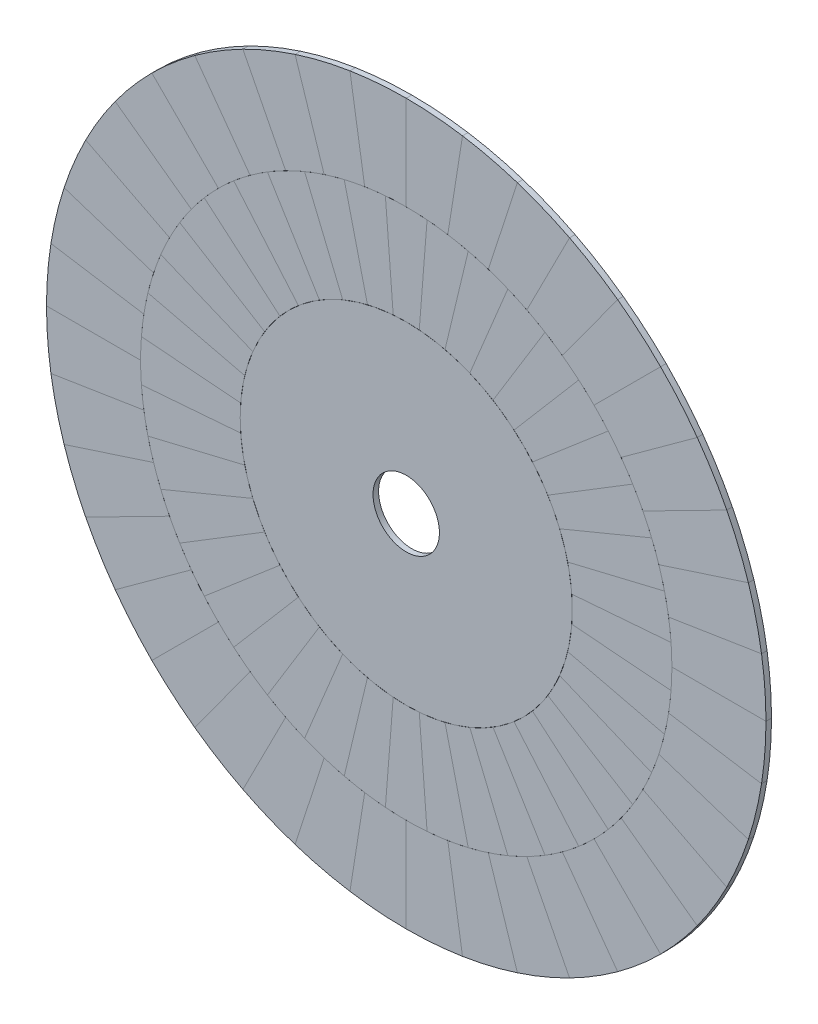
from build123d import *

# Parameters (mm, degrees)
BOSS_EXTRUDE1_DEPTH    = 0.5
BOSS_EXTRUDE1_2_DEPTH  = 0.5
BOSS_EXTRUDE1_3_DEPTH  = 0.5
BOSS_EXTRUDE1_4_DEPTH  = 0.5
BOSS_EXTRUDE1_5_DEPTH  = 0.5
BOSS_EXTRUDE1_6_DEPTH  = 0.5
BOSS_EXTRUDE1_7_DEPTH  = 0.5
BOSS_EXTRUDE1_8_DEPTH  = 0.5
BOSS_EXTRUDE1_9_DEPTH  = 0.5
BOSS_EXTRUDE1_10_DEPTH = 0.5
BOSS_EXTRUDE1_11_DEPTH = 0.5
BOSS_EXTRUDE1_12_DEPTH = 0.5
BOSS_EXTRUDE1_13_DEPTH = 0.5
BOSS_EXTRUDE1_14_DEPTH = 0.5
BOSS_EXTRUDE1_15_DEPTH = 0.5
BOSS_EXTRUDE1_16_DEPTH = 0.5
BOSS_EXTRUDE1_17_DEPTH = 0.5
BOSS_EXTRUDE1_18_DEPTH = 0.5
BOSS_EXTRUDE1_19_DEPTH = 0.5
BOSS_EXTRUDE1_20_DEPTH = 0.5
BOSS_EXTRUDE2_DEPTH    = 0.5
BOSS_EXTRUDE2_2_DEPTH  = 0.5
BOSS_EXTRUDE2_3_DEPTH  = 0.5
BOSS_EXTRUDE2_4_DEPTH  = 0.5
BOSS_EXTRUDE2_5_DEPTH  = 0.5
BOSS_EXTRUDE2_6_DEPTH  = 0.5
BOSS_EXTRUDE2_7_DEPTH  = 0.5
BOSS_EXTRUDE2_8_DEPTH  = 0.5
BOSS_EXTRUDE2_9_DEPTH  = 0.5
BOSS_EXTRUDE2_10_DEPTH = 0.5
BOSS_EXTRUDE2_11_DEPTH = 0.5
BOSS_EXTRUDE2_12_DEPTH = 0.5
BOSS_EXTRUDE2_13_DEPTH = 0.5
BOSS_EXTRUDE2_14_DEPTH = 0.5
BOSS_EXTRUDE2_15_DEPTH = 0.5
BOSS_EXTRUDE2_16_DEPTH = 0.5
BOSS_EXTRUDE2_17_DEPTH = 0.5
BOSS_EXTRUDE2_18_DEPTH = 0.5
BOSS_EXTRUDE2_19_DEPTH = 0.5
BOSS_EXTRUDE2_20_DEPTH = 0.5
BOSS_EXTRUDE3_DEPTH    = 0.5
BOSS_EXTRUDE3_2_DEPTH  = 0.5
BOSS_EXTRUDE3_3_DEPTH  = 0.5
BOSS_EXTRUDE3_4_DEPTH  = 0.5
BOSS_EXTRUDE3_5_DEPTH  = 0.5
BOSS_EXTRUDE3_6_DEPTH  = 0.5
BOSS_EXTRUDE3_7_DEPTH  = 0.5
BOSS_EXTRUDE3_8_DEPTH  = 0.5
BOSS_EXTRUDE3_9_DEPTH  = 0.5
BOSS_EXTRUDE3_10_DEPTH = 0.5
BOSS_EXTRUDE3_11_DEPTH = 0.5
BOSS_EXTRUDE3_12_DEPTH = 0.5
BOSS_EXTRUDE3_13_DEPTH = 0.5
BOSS_EXTRUDE3_14_DEPTH = 0.5
BOSS_EXTRUDE3_15_DEPTH = 0.5
BOSS_EXTRUDE3_16_DEPTH = 0.5
BOSS_EXTRUDE3_17_DEPTH = 0.5
BOSS_EXTRUDE3_18_DEPTH = 0.5
BOSS_EXTRUDE3_19_DEPTH = 0.5
BOSS_EXTRUDE3_20_DEPTH = 0.5
BOSS_EXTRUDE4_DEPTH    = 0.5
BOSS_EXTRUDE4_2_DEPTH  = 0.5
BOSS_EXTRUDE4_3_DEPTH  = 0.5
BOSS_EXTRUDE4_4_DEPTH  = 0.5
BOSS_EXTRUDE4_5_DEPTH  = 0.5
BOSS_EXTRUDE4_6_DEPTH  = 0.5
BOSS_EXTRUDE4_7_DEPTH  = 0.5
BOSS_EXTRUDE4_8_DEPTH  = 0.5
BOSS_EXTRUDE4_9_DEPTH  = 0.5
BOSS_EXTRUDE4_10_DEPTH = 0.5
BOSS_EXTRUDE4_11_DEPTH = 0.5
BOSS_EXTRUDE4_12_DEPTH = 0.5
BOSS_EXTRUDE4_13_DEPTH = 0.5
BOSS_EXTRUDE4_14_DEPTH = 0.5
BOSS_EXTRUDE4_15_DEPTH = 0.5
BOSS_EXTRUDE4_16_DEPTH = 0.5
BOSS_EXTRUDE4_17_DEPTH = 0.5
BOSS_EXTRUDE4_18_DEPTH = 0.5
BOSS_EXTRUDE4_19_DEPTH = 0.5
BOSS_EXTRUDE4_20_DEPTH = 0.5
SKETCH1_9_R            = 3
BOSS_EXTRUDE6_DEPTH    = 0.5


with BuildPart() as part:
    # Sketch1 → Boss-Extrude1 (new body)
    with BuildSketch(Plane.XY):
        with BuildLine():
            ThreePointArc((23.704520174, 3.754427161), (23.92601601, 1.883018297), (24, 0))
            Line((24, 0), (32.5, 0))
            ThreePointArc((32.5, 0), (32.399813346, 2.549920611), (32.099871069, 5.084120114))
            Line((32.099871069, 5.084120114), (23.704520174, 3.754427161))
        make_face()
    extrude(amount=BOSS_EXTRUDE1_DEPTH)


with BuildPart() as body_2:
    # Sketch1 → Boss-Extrude1 2 (new body)
    with BuildSketch(Plane.XY):
        with BuildLine():
            ThreePointArc((30.90933678, -10.043052317), (31.602022413, -7.586974325), (32.099871069, -5.084120114))
            Line((32.099871069, -5.084120114), (23.704520174, -3.754427161))
            ThreePointArc((23.704520174, -3.754427161), (23.33687809, -5.602688733), (22.825356391, -7.416407865))
            Line((22.825356391, -7.416407865), (30.90933678, -10.043052317))
        make_face()
    extrude(amount=BOSS_EXTRUDE1_2_DEPTH)


with BuildPart() as body_3:
    # Sketch1 → Boss-Extrude1 3 (new body)
    with BuildSketch(Plane.XY):
        with BuildLine():
            Line((22.825356391, 7.416407865), (30.90933678, 10.043052317))
            ThreePointArc((30.90933678, 10.043052317), (30.026084807, 12.437211552), (28.957712036, 14.754691242))
            Line((28.957712036, 14.754691242), (21.384156581, 10.895771994))
            ThreePointArc((21.384156581, 10.895771994), (22.17310878, 9.184402377), (22.825356391, 7.416407865))
        make_face()
    extrude(amount=BOSS_EXTRUDE1_3_DEPTH)


with BuildPart() as body_4:
    # Sketch1 → Boss-Extrude1 4 (new body)
    with BuildSketch(Plane.XY):
        with BuildLine():
            ThreePointArc((26.293052317, -19.1030207), (27.710805342, -16.981203353), (28.957712036, -14.754691242))
            Line((28.957712036, -14.754691242), (21.384156581, -10.895771994))
            ThreePointArc((21.384156581, -10.895771994), (20.463363944, -12.539965553), (19.416407865, -14.106846055))
            Line((19.416407865, -14.106846055), (26.293052317, -19.1030207))
        make_face()
    extrude(amount=BOSS_EXTRUDE1_4_DEPTH)


with BuildPart() as body_5:
    # Sketch1 → Boss-Extrude1 5 (new body)
    with BuildSketch(Plane.XY):
        with BuildLine():
            Line((19.416407865, 14.106846055), (26.293052317, 19.1030207))
            ThreePointArc((26.293052317, 19.1030207), (24.713193882, 21.107061571), (22.980970389, 22.980970389))
            Line((22.980970389, 22.980970389), (16.970562748, 16.970562748))
            ThreePointArc((16.970562748, 16.970562748), (18.249743174, 15.58675316), (19.416407865, 14.106846055))
        make_face()
    extrude(amount=BOSS_EXTRUDE1_5_DEPTH)


with BuildPart() as body_6:
    # Sketch1 → Boss-Extrude1 6 (new body)
    with BuildSketch(Plane.XY):
        with BuildLine():
            ThreePointArc((19.1030207, -26.293052317), (21.107061571, -24.713193882), (22.980970389, -22.980970389))
            Line((22.980970389, -22.980970389), (16.970562748, -16.970562748))
            ThreePointArc((16.970562748, -16.970562748), (15.58675316, -18.249743174), (14.106846055, -19.416407865))
            Line((14.106846055, -19.416407865), (19.1030207, -26.293052317))
        make_face()
    extrude(amount=BOSS_EXTRUDE1_6_DEPTH)


with BuildPart() as body_7:
    # Sketch1 → Boss-Extrude1 7 (new body)
    with BuildSketch(Plane.XY):
        with BuildLine():
            Line((14.106846055, 19.416407865), (19.1030207, 26.293052317))
            ThreePointArc((19.1030207, 26.293052317), (16.981203353, 27.710805342), (14.754691242, 28.957712036))
            Line((14.754691242, 28.957712036), (10.895771994, 21.384156581))
            ThreePointArc((10.895771994, 21.384156581), (12.539965553, 20.463363944), (14.106846055, 19.416407865))
        make_face()
    extrude(amount=BOSS_EXTRUDE1_7_DEPTH)


with BuildPart() as body_8:
    # Sketch1 → Boss-Extrude1 8 (new body)
    with BuildSketch(Plane.XY):
        with BuildLine():
            ThreePointArc((10.043052317, -30.90933678), (12.437211552, -30.026084807), (14.754691242, -28.957712036))
            Line((14.754691242, -28.957712036), (10.895771994, -21.384156581))
            ThreePointArc((10.895771994, -21.384156581), (9.184402377, -22.17310878), (7.416407865, -22.825356391))
            Line((7.416407865, -22.825356391), (10.043052317, -30.90933678))
        make_face()
    extrude(amount=BOSS_EXTRUDE1_8_DEPTH)


with BuildPart() as body_9:
    # Sketch1 → Boss-Extrude1 9 (new body)
    with BuildSketch(Plane.XY):
        with BuildLine():
            Line((7.416407865, 22.825356391), (10.043052317, 30.90933678))
            ThreePointArc((10.043052317, 30.90933678), (7.586974325, 31.602022413), (5.084120114, 32.099871069))
            Line((5.084120114, 32.099871069), (3.754427161, 23.704520174))
            ThreePointArc((3.754427161, 23.704520174), (5.602688733, 23.33687809), (7.416407865, 22.825356391))
        make_face()
    extrude(amount=BOSS_EXTRUDE1_9_DEPTH)


with BuildPart() as body_10:
    # Sketch1 → Boss-Extrude1 10 (new body)
    with BuildSketch(Plane.XY):
        with BuildLine():
            ThreePointArc((0, -32.5), (2.549920611, -32.399813346), (5.084120114, -32.099871069))
            Line((5.084120114, -32.099871069), (3.754427161, -23.704520174))
            ThreePointArc((3.754427161, -23.704520174), (1.883018297, -23.92601601), (0, -24))
            Line((0, -24), (0, -32.5))
        make_face()
    extrude(amount=BOSS_EXTRUDE1_10_DEPTH)


with BuildPart() as body_11:
    # Sketch1 → Boss-Extrude1 11 (new body)
    with BuildSketch(Plane.XY):
        with BuildLine():
            Line((0, 24), (0, 32.5))
            ThreePointArc((0, 32.5), (-2.549920611, 32.399813346), (-5.084120114, 32.099871069))
            Line((-5.084120114, 32.099871069), (-3.754427161, 23.704520174))
            ThreePointArc((-3.754427161, 23.704520174), (-1.883018297, 23.92601601), (0, 24))
        make_face()
    extrude(amount=BOSS_EXTRUDE1_11_DEPTH)


with BuildPart() as body_12:
    # Sketch1 → Boss-Extrude1 12 (new body)
    with BuildSketch(Plane.XY):
        with BuildLine():
            ThreePointArc((-10.043052317, -30.90933678), (-7.586974325, -31.602022413), (-5.084120114, -32.099871069))
            Line((-5.084120114, -32.099871069), (-3.754427161, -23.704520174))
            ThreePointArc((-3.754427161, -23.704520174), (-5.602688733, -23.33687809), (-7.416407865, -22.825356391))
            Line((-7.416407865, -22.825356391), (-10.043052317, -30.90933678))
        make_face()
    extrude(amount=BOSS_EXTRUDE1_12_DEPTH)


with BuildPart() as body_13:
    # Sketch1 → Boss-Extrude1 13 (new body)
    with BuildSketch(Plane.XY):
        with BuildLine():
            Line((-7.416407865, 22.825356391), (-10.043052317, 30.90933678))
            ThreePointArc((-10.043052317, 30.90933678), (-12.437211552, 30.026084807), (-14.754691242, 28.957712036))
            Line((-14.754691242, 28.957712036), (-10.895771994, 21.384156581))
            ThreePointArc((-10.895771994, 21.384156581), (-9.184402377, 22.17310878), (-7.416407865, 22.825356391))
        make_face()
    extrude(amount=BOSS_EXTRUDE1_13_DEPTH)


with BuildPart() as body_14:
    # Sketch1 → Boss-Extrude1 14 (new body)
    with BuildSketch(Plane.XY):
        with BuildLine():
            ThreePointArc((-19.1030207, -26.293052317), (-16.981203353, -27.710805342), (-14.754691242, -28.957712036))
            Line((-14.754691242, -28.957712036), (-10.895771994, -21.384156581))
            ThreePointArc((-10.895771994, -21.384156581), (-12.539965553, -20.463363944), (-14.106846055, -19.416407865))
            Line((-14.106846055, -19.416407865), (-19.1030207, -26.293052317))
        make_face()
    extrude(amount=BOSS_EXTRUDE1_14_DEPTH)


with BuildPart() as body_15:
    # Sketch1 → Boss-Extrude1 15 (new body)
    with BuildSketch(Plane.XY):
        with BuildLine():
            Line((-14.106846055, 19.416407865), (-19.1030207, 26.293052317))
            ThreePointArc((-19.1030207, 26.293052317), (-21.107061571, 24.713193882), (-22.980970389, 22.980970389))
            Line((-22.980970389, 22.980970389), (-16.970562748, 16.970562748))
            ThreePointArc((-16.970562748, 16.970562748), (-15.58675316, 18.249743174), (-14.106846055, 19.416407865))
        make_face()
    extrude(amount=BOSS_EXTRUDE1_15_DEPTH)


with BuildPart() as body_16:
    # Sketch1 → Boss-Extrude1 16 (new body)
    with BuildSketch(Plane.XY):
        with BuildLine():
            ThreePointArc((-26.293052317, -19.1030207), (-24.713193882, -21.107061571), (-22.980970389, -22.980970389))
            Line((-22.980970389, -22.980970389), (-16.970562748, -16.970562748))
            ThreePointArc((-16.970562748, -16.970562748), (-18.249743174, -15.58675316), (-19.416407865, -14.106846055))
            Line((-19.416407865, -14.106846055), (-26.293052317, -19.1030207))
        make_face()
    extrude(amount=BOSS_EXTRUDE1_16_DEPTH)


with BuildPart() as body_17:
    # Sketch1 → Boss-Extrude1 17 (new body)
    with BuildSketch(Plane.XY):
        with BuildLine():
            Line((-19.416407865, 14.106846055), (-26.293052317, 19.1030207))
            ThreePointArc((-26.293052317, 19.1030207), (-27.710805342, 16.981203353), (-28.957712036, 14.754691242))
            Line((-28.957712036, 14.754691242), (-21.384156581, 10.895771994))
            ThreePointArc((-21.384156581, 10.895771994), (-20.463363944, 12.539965553), (-19.416407865, 14.106846055))
        make_face()
    extrude(amount=BOSS_EXTRUDE1_17_DEPTH)


with BuildPart() as body_18:
    # Sketch1 → Boss-Extrude1 18 (new body)
    with BuildSketch(Plane.XY):
        with BuildLine():
            ThreePointArc((-30.90933678, -10.043052317), (-30.026084807, -12.437211552), (-28.957712036, -14.754691242))
            Line((-28.957712036, -14.754691242), (-21.384156581, -10.895771994))
            ThreePointArc((-21.384156581, -10.895771994), (-22.17310878, -9.184402377), (-22.825356391, -7.416407865))
            Line((-22.825356391, -7.416407865), (-30.90933678, -10.043052317))
        make_face()
    extrude(amount=BOSS_EXTRUDE1_18_DEPTH)


with BuildPart() as body_19:
    # Sketch1 → Boss-Extrude1 19 (new body)
    with BuildSketch(Plane.XY):
        with BuildLine():
            Line((-22.825356391, 7.416407865), (-30.90933678, 10.043052317))
            ThreePointArc((-30.90933678, 10.043052317), (-31.602022413, 7.586974325), (-32.099871069, 5.084120114))
            Line((-32.099871069, 5.084120114), (-23.704520174, 3.754427161))
            ThreePointArc((-23.704520174, 3.754427161), (-23.33687809, 5.602688733), (-22.825356391, 7.416407865))
        make_face()
    extrude(amount=BOSS_EXTRUDE1_19_DEPTH)


with BuildPart() as body_20:
    # Sketch1 → Boss-Extrude1 20 (new body)
    with BuildSketch(Plane.XY):
        with BuildLine():
            ThreePointArc((-32.5, 0), (-32.399813346, -2.549920611), (-32.099871069, -5.084120114))
            Line((-32.099871069, -5.084120114), (-23.704520174, -3.754427161))
            ThreePointArc((-23.704520174, -3.754427161), (-23.92601601, -1.883018297), (-24, 0))
            Line((-24, 0), (-32.5, 0))
        make_face()
    extrude(amount=BOSS_EXTRUDE1_20_DEPTH)


with BuildPart() as body_21:
    # Sketch1<3> → Boss-Extrude2 (new body)
    with BuildSketch(Plane.XY):
        with BuildLine():
            Line((32.5, 0), (24, 0))
            ThreePointArc((24, 0), (23.92601601, -1.883018297), (23.704520174, -3.754427161))
            Line((23.704520174, -3.754427161), (32.099871069, -5.084120114))
            ThreePointArc((32.099871069, -5.084120114), (32.399813346, -2.549920611), (32.5, 0))
        make_face()
    extrude(amount=BOSS_EXTRUDE2_DEPTH)


with BuildPart() as body_22:
    # Sketch1<3> → Boss-Extrude2 2 (new body)
    with BuildSketch(Plane.XY):
        with BuildLine():
            Line((23.704520174, 3.754427161), (32.099871069, 5.084120114))
            ThreePointArc((32.099871069, 5.084120114), (31.602022413, 7.586974325), (30.90933678, 10.043052317))
            Line((30.90933678, 10.043052317), (22.825356391, 7.416407865))
            ThreePointArc((22.825356391, 7.416407865), (23.33687809, 5.602688733), (23.704520174, 3.754427161))
        make_face()
    extrude(amount=BOSS_EXTRUDE2_2_DEPTH)


with BuildPart() as body_23:
    # Sketch1<3> → Boss-Extrude2 3 (new body)
    with BuildSketch(Plane.XY):
        with BuildLine():
            ThreePointArc((28.957712036, -14.754691242), (30.026084807, -12.437211552), (30.90933678, -10.043052317))
            Line((30.90933678, -10.043052317), (22.825356391, -7.416407865))
            ThreePointArc((22.825356391, -7.416407865), (22.17310878, -9.184402377), (21.384156581, -10.895771994))
            Line((21.384156581, -10.895771994), (28.957712036, -14.754691242))
        make_face()
    extrude(amount=BOSS_EXTRUDE2_3_DEPTH)


with BuildPart() as body_24:
    # Sketch1<3> → Boss-Extrude2 4 (new body)
    with BuildSketch(Plane.XY):
        with BuildLine():
            Line((21.384156581, 10.895771994), (28.957712036, 14.754691242))
            ThreePointArc((28.957712036, 14.754691242), (27.710805342, 16.981203353), (26.293052317, 19.1030207))
            Line((26.293052317, 19.1030207), (19.416407865, 14.106846055))
            ThreePointArc((19.416407865, 14.106846055), (20.463363944, 12.539965553), (21.384156581, 10.895771994))
        make_face()
    extrude(amount=BOSS_EXTRUDE2_4_DEPTH)


with BuildPart() as body_25:
    # Sketch1<3> → Boss-Extrude2 5 (new body)
    with BuildSketch(Plane.XY):
        with BuildLine():
            ThreePointArc((22.980970389, -22.980970389), (24.713193882, -21.107061571), (26.293052317, -19.1030207))
            Line((26.293052317, -19.1030207), (19.416407865, -14.106846055))
            ThreePointArc((19.416407865, -14.106846055), (18.249743174, -15.58675316), (16.970562748, -16.970562748))
            Line((16.970562748, -16.970562748), (22.980970389, -22.980970389))
        make_face()
    extrude(amount=BOSS_EXTRUDE2_5_DEPTH)


with BuildPart() as body_26:
    # Sketch1<3> → Boss-Extrude2 6 (new body)
    with BuildSketch(Plane.XY):
        with BuildLine():
            Line((16.970562748, 16.970562748), (22.980970389, 22.980970389))
            ThreePointArc((22.980970389, 22.980970389), (21.107061571, 24.713193882), (19.1030207, 26.293052317))
            Line((19.1030207, 26.293052317), (14.106846055, 19.416407865))
            ThreePointArc((14.106846055, 19.416407865), (15.58675316, 18.249743174), (16.970562748, 16.970562748))
        make_face()
    extrude(amount=BOSS_EXTRUDE2_6_DEPTH)


with BuildPart() as body_27:
    # Sketch1<3> → Boss-Extrude2 7 (new body)
    with BuildSketch(Plane.XY):
        with BuildLine():
            ThreePointArc((14.754691242, -28.957712036), (16.981203353, -27.710805342), (19.1030207, -26.293052317))
            Line((19.1030207, -26.293052317), (14.106846055, -19.416407865))
            ThreePointArc((14.106846055, -19.416407865), (12.539965553, -20.463363944), (10.895771994, -21.384156581))
            Line((10.895771994, -21.384156581), (14.754691242, -28.957712036))
        make_face()
    extrude(amount=BOSS_EXTRUDE2_7_DEPTH)


with BuildPart() as body_28:
    # Sketch1<3> → Boss-Extrude2 8 (new body)
    with BuildSketch(Plane.XY):
        with BuildLine():
            Line((10.895771994, 21.384156581), (14.754691242, 28.957712036))
            ThreePointArc((14.754691242, 28.957712036), (12.437211552, 30.026084807), (10.043052317, 30.90933678))
            Line((10.043052317, 30.90933678), (7.416407865, 22.825356391))
            ThreePointArc((7.416407865, 22.825356391), (9.184402377, 22.17310878), (10.895771994, 21.384156581))
        make_face()
    extrude(amount=BOSS_EXTRUDE2_8_DEPTH)


with BuildPart() as body_29:
    # Sketch1<3> → Boss-Extrude2 9 (new body)
    with BuildSketch(Plane.XY):
        with BuildLine():
            ThreePointArc((5.084120114, -32.099871069), (7.586974325, -31.602022413), (10.043052317, -30.90933678))
            Line((10.043052317, -30.90933678), (7.416407865, -22.825356391))
            ThreePointArc((7.416407865, -22.825356391), (5.602688733, -23.33687809), (3.754427161, -23.704520174))
            Line((3.754427161, -23.704520174), (5.084120114, -32.099871069))
        make_face()
    extrude(amount=BOSS_EXTRUDE2_9_DEPTH)


with BuildPart() as body_30:
    # Sketch1<3> → Boss-Extrude2 10 (new body)
    with BuildSketch(Plane.XY):
        with BuildLine():
            Line((3.754427161, 23.704520174), (5.084120114, 32.099871069))
            ThreePointArc((5.084120114, 32.099871069), (2.549920611, 32.399813346), (0, 32.5))
            Line((0, 32.5), (0, 24))
            ThreePointArc((0, 24), (1.883018297, 23.92601601), (3.754427161, 23.704520174))
        make_face()
    extrude(amount=BOSS_EXTRUDE2_10_DEPTH)


with BuildPart() as body_31:
    # Sketch1<3> → Boss-Extrude2 11 (new body)
    with BuildSketch(Plane.XY):
        with BuildLine():
            ThreePointArc((-5.084120114, -32.099871069), (-2.549920611, -32.399813346), (0, -32.5))
            Line((0, -32.5), (0, -24))
            ThreePointArc((0, -24), (-1.883018297, -23.92601601), (-3.754427161, -23.704520174))
            Line((-3.754427161, -23.704520174), (-5.084120114, -32.099871069))
        make_face()
    extrude(amount=BOSS_EXTRUDE2_11_DEPTH)


with BuildPart() as body_32:
    # Sketch1<3> → Boss-Extrude2 12 (new body)
    with BuildSketch(Plane.XY):
        with BuildLine():
            Line((-3.754427161, 23.704520174), (-5.084120114, 32.099871069))
            ThreePointArc((-5.084120114, 32.099871069), (-7.586974325, 31.602022413), (-10.043052317, 30.90933678))
            Line((-10.043052317, 30.90933678), (-7.416407865, 22.825356391))
            ThreePointArc((-7.416407865, 22.825356391), (-5.602688733, 23.33687809), (-3.754427161, 23.704520174))
        make_face()
    extrude(amount=BOSS_EXTRUDE2_12_DEPTH)


with BuildPart() as body_33:
    # Sketch1<3> → Boss-Extrude2 13 (new body)
    with BuildSketch(Plane.XY):
        with BuildLine():
            ThreePointArc((-14.754691242, -28.957712036), (-12.437211552, -30.026084807), (-10.043052317, -30.90933678))
            Line((-10.043052317, -30.90933678), (-7.416407865, -22.825356391))
            ThreePointArc((-7.416407865, -22.825356391), (-9.184402377, -22.17310878), (-10.895771994, -21.384156581))
            Line((-10.895771994, -21.384156581), (-14.754691242, -28.957712036))
        make_face()
    extrude(amount=BOSS_EXTRUDE2_13_DEPTH)


with BuildPart() as body_34:
    # Sketch1<3> → Boss-Extrude2 14 (new body)
    with BuildSketch(Plane.XY):
        with BuildLine():
            Line((-10.895771994, 21.384156581), (-14.754691242, 28.957712036))
            ThreePointArc((-14.754691242, 28.957712036), (-16.981203353, 27.710805342), (-19.1030207, 26.293052317))
            Line((-19.1030207, 26.293052317), (-14.106846055, 19.416407865))
            ThreePointArc((-14.106846055, 19.416407865), (-12.539965553, 20.463363944), (-10.895771994, 21.384156581))
        make_face()
    extrude(amount=BOSS_EXTRUDE2_14_DEPTH)


with BuildPart() as body_35:
    # Sketch1<3> → Boss-Extrude2 15 (new body)
    with BuildSketch(Plane.XY):
        with BuildLine():
            ThreePointArc((-22.980970389, -22.980970389), (-21.107061571, -24.713193882), (-19.1030207, -26.293052317))
            Line((-19.1030207, -26.293052317), (-14.106846055, -19.416407865))
            ThreePointArc((-14.106846055, -19.416407865), (-15.58675316, -18.249743174), (-16.970562748, -16.970562748))
            Line((-16.970562748, -16.970562748), (-22.980970389, -22.980970389))
        make_face()
    extrude(amount=BOSS_EXTRUDE2_15_DEPTH)


with BuildPart() as body_36:
    # Sketch1<3> → Boss-Extrude2 16 (new body)
    with BuildSketch(Plane.XY):
        with BuildLine():
            Line((-16.970562748, 16.970562748), (-22.980970389, 22.980970389))
            ThreePointArc((-22.980970389, 22.980970389), (-24.713193882, 21.107061571), (-26.293052317, 19.1030207))
            Line((-26.293052317, 19.1030207), (-19.416407865, 14.106846055))
            ThreePointArc((-19.416407865, 14.106846055), (-18.249743174, 15.58675316), (-16.970562748, 16.970562748))
        make_face()
    extrude(amount=BOSS_EXTRUDE2_16_DEPTH)


with BuildPart() as body_37:
    # Sketch1<3> → Boss-Extrude2 17 (new body)
    with BuildSketch(Plane.XY):
        with BuildLine():
            ThreePointArc((-28.957712036, -14.754691242), (-27.710805342, -16.981203353), (-26.293052317, -19.1030207))
            Line((-26.293052317, -19.1030207), (-19.416407865, -14.106846055))
            ThreePointArc((-19.416407865, -14.106846055), (-20.463363944, -12.539965553), (-21.384156581, -10.895771994))
            Line((-21.384156581, -10.895771994), (-28.957712036, -14.754691242))
        make_face()
    extrude(amount=BOSS_EXTRUDE2_17_DEPTH)


with BuildPart() as body_38:
    # Sketch1<3> → Boss-Extrude2 18 (new body)
    with BuildSketch(Plane.XY):
        with BuildLine():
            Line((-21.384156581, 10.895771994), (-28.957712036, 14.754691242))
            ThreePointArc((-28.957712036, 14.754691242), (-30.026084807, 12.437211552), (-30.90933678, 10.043052317))
            Line((-30.90933678, 10.043052317), (-22.825356391, 7.416407865))
            ThreePointArc((-22.825356391, 7.416407865), (-22.17310878, 9.184402377), (-21.384156581, 10.895771994))
        make_face()
    extrude(amount=BOSS_EXTRUDE2_18_DEPTH)


with BuildPart() as body_39:
    # Sketch1<3> → Boss-Extrude2 19 (new body)
    with BuildSketch(Plane.XY):
        with BuildLine():
            ThreePointArc((-32.099871069, -5.084120114), (-31.602022413, -7.586974325), (-30.90933678, -10.043052317))
            Line((-30.90933678, -10.043052317), (-22.825356391, -7.416407865))
            ThreePointArc((-22.825356391, -7.416407865), (-23.33687809, -5.602688733), (-23.704520174, -3.754427161))
            Line((-23.704520174, -3.754427161), (-32.099871069, -5.084120114))
        make_face()
    extrude(amount=BOSS_EXTRUDE2_19_DEPTH)


with BuildPart() as body_40:
    # Sketch1<3> → Boss-Extrude2 20 (new body)
    with BuildSketch(Plane.XY):
        with BuildLine():
            Line((-23.704520174, 3.754427161), (-32.099871069, 5.084120114))
            ThreePointArc((-32.099871069, 5.084120114), (-32.399813346, 2.549920611), (-32.5, 0))
            Line((-32.5, 0), (-24, 0))
            ThreePointArc((-24, 0), (-23.92601601, 1.883018297), (-23.704520174, 3.754427161))
        make_face()
    extrude(amount=BOSS_EXTRUDE2_20_DEPTH)


with BuildPart() as body_41:
    # Sketch1<4> → Boss-Extrude3 (new body)
    with BuildSketch(Plane.XY):
        with BuildLine():
            ThreePointArc((23.92601601, -1.883018297), (24, 0), (23.92601601, 1.883018297))
            Line((23.92601601, 1.883018297), (14.953760006, 1.176886436))
            ThreePointArc((14.953760006, 1.176886436), (15, 0), (14.953760006, -1.176886436))
            Line((14.953760006, -1.176886436), (23.92601601, -1.883018297))
        make_face()
    extrude(amount=BOSS_EXTRUDE3_DEPTH)


with BuildPart() as body_42:
    # Sketch1<4> → Boss-Extrude3 2 (new body)
    with BuildSketch(Plane.XY):
        with BuildLine():
            ThreePointArc((13.858192988, 5.740251485), (14.265847744, 4.635254916), (14.585548806, 3.501680458))
            Line((14.585548806, 3.501680458), (23.33687809, 5.602688733))
            ThreePointArc((23.33687809, 5.602688733), (22.825356391, 7.416407865), (22.17310878, 9.184402377))
            Line((22.17310878, 9.184402377), (13.858192988, 5.740251485))
        make_face()
    extrude(amount=BOSS_EXTRUDE3_2_DEPTH)


with BuildPart() as body_43:
    # Sketch1<4> → Boss-Extrude3 3 (new body)
    with BuildSketch(Plane.XY):
        with BuildLine():
            Line((23.33687809, -5.602688733), (14.585548806, -3.501680458))
            ThreePointArc((14.585548806, -3.501680458), (14.265847744, -4.635254916), (13.858192988, -5.740251485))
            Line((13.858192988, -5.740251485), (22.17310878, -9.184402377))
            ThreePointArc((22.17310878, -9.184402377), (22.825356391, -7.416407865), (23.33687809, -5.602688733))
        make_face()
    extrude(amount=BOSS_EXTRUDE3_3_DEPTH)


with BuildPart() as body_44:
    # Sketch1<4> → Boss-Extrude3 4 (new body)
    with BuildSketch(Plane.XY):
        with BuildLine():
            ThreePointArc((11.406089484, 9.741720725), (12.135254916, 8.816778784), (12.789602465, 7.837478471))
            Line((12.789602465, 7.837478471), (20.463363944, 12.539965553))
            ThreePointArc((20.463363944, 12.539965553), (19.416407865, 14.106846055), (18.249743174, 15.58675316))
            Line((18.249743174, 15.58675316), (11.406089484, 9.741720725))
        make_face()
    extrude(amount=BOSS_EXTRUDE3_4_DEPTH)


with BuildPart() as body_45:
    # Sketch1<4> → Boss-Extrude3 5 (new body)
    with BuildSketch(Plane.XY):
        with BuildLine():
            Line((20.463363944, -12.539965553), (12.789602465, -7.837478471))
            ThreePointArc((12.789602465, -7.837478471), (12.135254916, -8.816778784), (11.406089484, -9.741720725))
            Line((11.406089484, -9.741720725), (18.249743174, -15.58675316))
            ThreePointArc((18.249743174, -15.58675316), (19.416407865, -14.106846055), (20.463363944, -12.539965553))
        make_face()
    extrude(amount=BOSS_EXTRUDE3_5_DEPTH)


with BuildPart() as body_46:
    # Sketch1<4> → Boss-Extrude3 6 (new body)
    with BuildSketch(Plane.XY):
        with BuildLine():
            ThreePointArc((7.837478471, 12.789602465), (8.816778784, 12.135254916), (9.741720725, 11.406089484))
            Line((9.741720725, 11.406089484), (15.58675316, 18.249743174))
            ThreePointArc((15.58675316, 18.249743174), (14.106846055, 19.416407865), (12.539965553, 20.463363944))
            Line((12.539965553, 20.463363944), (7.837478471, 12.789602465))
        make_face()
    extrude(amount=BOSS_EXTRUDE3_6_DEPTH)


with BuildPart() as body_47:
    # Sketch1<4> → Boss-Extrude3 7 (new body)
    with BuildSketch(Plane.XY):
        with BuildLine():
            Line((15.58675316, -18.249743174), (9.741720725, -11.406089484))
            ThreePointArc((9.741720725, -11.406089484), (8.816778784, -12.135254916), (7.837478471, -12.789602465))
            Line((7.837478471, -12.789602465), (12.539965553, -20.463363944))
            ThreePointArc((12.539965553, -20.463363944), (14.106846055, -19.416407865), (15.58675316, -18.249743174))
        make_face()
    extrude(amount=BOSS_EXTRUDE3_7_DEPTH)


with BuildPart() as body_48:
    # Sketch1<4> → Boss-Extrude3 8 (new body)
    with BuildSketch(Plane.XY):
        with BuildLine():
            ThreePointArc((3.501680458, 14.585548806), (4.635254916, 14.265847744), (5.740251485, 13.858192988))
            Line((5.740251485, 13.858192988), (9.184402377, 22.17310878))
            ThreePointArc((9.184402377, 22.17310878), (7.416407865, 22.825356391), (5.602688733, 23.33687809))
            Line((5.602688733, 23.33687809), (3.501680458, 14.585548806))
        make_face()
    extrude(amount=BOSS_EXTRUDE3_8_DEPTH)


with BuildPart() as body_49:
    # Sketch1<4> → Boss-Extrude3 9 (new body)
    with BuildSketch(Plane.XY):
        with BuildLine():
            Line((9.184402377, -22.17310878), (5.740251485, -13.858192988))
            ThreePointArc((5.740251485, -13.858192988), (4.635254916, -14.265847744), (3.501680458, -14.585548806))
            Line((3.501680458, -14.585548806), (5.602688733, -23.33687809))
            ThreePointArc((5.602688733, -23.33687809), (7.416407865, -22.825356391), (9.184402377, -22.17310878))
        make_face()
    extrude(amount=BOSS_EXTRUDE3_9_DEPTH)


with BuildPart() as body_50:
    # Sketch1<4> → Boss-Extrude3 10 (new body)
    with BuildSketch(Plane.XY):
        with BuildLine():
            ThreePointArc((-1.176886436, 14.953760006), (0, 15), (1.176886436, 14.953760006))
            Line((1.176886436, 14.953760006), (1.883018297, 23.92601601))
            ThreePointArc((1.883018297, 23.92601601), (0, 24), (-1.883018297, 23.92601601))
            Line((-1.883018297, 23.92601601), (-1.176886436, 14.953760006))
        make_face()
    extrude(amount=BOSS_EXTRUDE3_10_DEPTH)


with BuildPart() as body_51:
    # Sketch1<4> → Boss-Extrude3 11 (new body)
    with BuildSketch(Plane.XY):
        with BuildLine():
            Line((1.883018297, -23.92601601), (1.176886436, -14.953760006))
            ThreePointArc((1.176886436, -14.953760006), (0, -15), (-1.176886436, -14.953760006))
            Line((-1.176886436, -14.953760006), (-1.883018297, -23.92601601))
            ThreePointArc((-1.883018297, -23.92601601), (0, -24), (1.883018297, -23.92601601))
        make_face()
    extrude(amount=BOSS_EXTRUDE3_11_DEPTH)


with BuildPart() as body_52:
    # Sketch1<4> → Boss-Extrude3 12 (new body)
    with BuildSketch(Plane.XY):
        with BuildLine():
            ThreePointArc((-5.740251485, 13.858192988), (-4.635254916, 14.265847744), (-3.501680458, 14.585548806))
            Line((-3.501680458, 14.585548806), (-5.602688733, 23.33687809))
            ThreePointArc((-5.602688733, 23.33687809), (-7.416407865, 22.825356391), (-9.184402377, 22.17310878))
            Line((-9.184402377, 22.17310878), (-5.740251485, 13.858192988))
        make_face()
    extrude(amount=BOSS_EXTRUDE3_12_DEPTH)


with BuildPart() as body_53:
    # Sketch1<4> → Boss-Extrude3 13 (new body)
    with BuildSketch(Plane.XY):
        with BuildLine():
            Line((-5.602688733, -23.33687809), (-3.501680458, -14.585548806))
            ThreePointArc((-3.501680458, -14.585548806), (-4.635254916, -14.265847744), (-5.740251485, -13.858192988))
            Line((-5.740251485, -13.858192988), (-9.184402377, -22.17310878))
            ThreePointArc((-9.184402377, -22.17310878), (-7.416407865, -22.825356391), (-5.602688733, -23.33687809))
        make_face()
    extrude(amount=BOSS_EXTRUDE3_13_DEPTH)


with BuildPart() as body_54:
    # Sketch1<4> → Boss-Extrude3 14 (new body)
    with BuildSketch(Plane.XY):
        with BuildLine():
            ThreePointArc((-9.741720725, 11.406089484), (-8.816778784, 12.135254916), (-7.837478471, 12.789602465))
            Line((-7.837478471, 12.789602465), (-12.539965553, 20.463363944))
            ThreePointArc((-12.539965553, 20.463363944), (-14.106846055, 19.416407865), (-15.58675316, 18.249743174))
            Line((-15.58675316, 18.249743174), (-9.741720725, 11.406089484))
        make_face()
    extrude(amount=BOSS_EXTRUDE3_14_DEPTH)


with BuildPart() as body_55:
    # Sketch1<4> → Boss-Extrude3 15 (new body)
    with BuildSketch(Plane.XY):
        with BuildLine():
            Line((-12.539965553, -20.463363944), (-7.837478471, -12.789602465))
            ThreePointArc((-7.837478471, -12.789602465), (-8.816778784, -12.135254916), (-9.741720725, -11.406089484))
            Line((-9.741720725, -11.406089484), (-15.58675316, -18.249743174))
            ThreePointArc((-15.58675316, -18.249743174), (-14.106846055, -19.416407865), (-12.539965553, -20.463363944))
        make_face()
    extrude(amount=BOSS_EXTRUDE3_15_DEPTH)


with BuildPart() as body_56:
    # Sketch1<4> → Boss-Extrude3 16 (new body)
    with BuildSketch(Plane.XY):
        with BuildLine():
            ThreePointArc((-12.789602465, 7.837478471), (-12.135254916, 8.816778784), (-11.406089484, 9.741720725))
            Line((-11.406089484, 9.741720725), (-18.249743174, 15.58675316))
            ThreePointArc((-18.249743174, 15.58675316), (-19.416407865, 14.106846055), (-20.463363944, 12.539965553))
            Line((-20.463363944, 12.539965553), (-12.789602465, 7.837478471))
        make_face()
    extrude(amount=BOSS_EXTRUDE3_16_DEPTH)


with BuildPart() as body_57:
    # Sketch1<4> → Boss-Extrude3 17 (new body)
    with BuildSketch(Plane.XY):
        with BuildLine():
            Line((-18.249743174, -15.58675316), (-11.406089484, -9.741720725))
            ThreePointArc((-11.406089484, -9.741720725), (-12.135254916, -8.816778784), (-12.789602465, -7.837478471))
            Line((-12.789602465, -7.837478471), (-20.463363944, -12.539965553))
            ThreePointArc((-20.463363944, -12.539965553), (-19.416407865, -14.106846055), (-18.249743174, -15.58675316))
        make_face()
    extrude(amount=BOSS_EXTRUDE3_17_DEPTH)


with BuildPart() as body_58:
    # Sketch1<4> → Boss-Extrude3 18 (new body)
    with BuildSketch(Plane.XY):
        with BuildLine():
            ThreePointArc((-14.585548806, 3.501680458), (-14.265847744, 4.635254916), (-13.858192988, 5.740251485))
            Line((-13.858192988, 5.740251485), (-22.17310878, 9.184402377))
            ThreePointArc((-22.17310878, 9.184402377), (-22.825356391, 7.416407865), (-23.33687809, 5.602688733))
            Line((-23.33687809, 5.602688733), (-14.585548806, 3.501680458))
        make_face()
    extrude(amount=BOSS_EXTRUDE3_18_DEPTH)


with BuildPart() as body_59:
    # Sketch1<4> → Boss-Extrude3 19 (new body)
    with BuildSketch(Plane.XY):
        with BuildLine():
            Line((-22.17310878, -9.184402377), (-13.858192988, -5.740251485))
            ThreePointArc((-13.858192988, -5.740251485), (-14.265847744, -4.635254916), (-14.585548806, -3.501680458))
            Line((-14.585548806, -3.501680458), (-23.33687809, -5.602688733))
            ThreePointArc((-23.33687809, -5.602688733), (-22.825356391, -7.416407865), (-22.17310878, -9.184402377))
        make_face()
    extrude(amount=BOSS_EXTRUDE3_19_DEPTH)


with BuildPart() as body_60:
    # Sketch1<4> → Boss-Extrude3 20 (new body)
    with BuildSketch(Plane.XY):
        with BuildLine():
            ThreePointArc((-14.953760006, -1.176886436), (-15, 0), (-14.953760006, 1.176886436))
            Line((-14.953760006, 1.176886436), (-23.92601601, 1.883018297))
            ThreePointArc((-23.92601601, 1.883018297), (-24, 0), (-23.92601601, -1.883018297))
            Line((-23.92601601, -1.883018297), (-14.953760006, -1.176886436))
        make_face()
    extrude(amount=BOSS_EXTRUDE3_20_DEPTH)


with BuildPart() as body_61:
    # Sketch1<5> → Boss-Extrude4 (new body)
    with BuildSketch(Plane.XY):
        with BuildLine():
            Line((14.953760006, 1.176886436), (23.92601601, 1.883018297))
            ThreePointArc((23.92601601, 1.883018297), (23.704520174, 3.754427161), (23.33687809, 5.602688733))
            Line((23.33687809, 5.602688733), (14.585548806, 3.501680458))
            ThreePointArc((14.585548806, 3.501680458), (14.815325109, 2.346516976), (14.953760006, 1.176886436))
        make_face()
    extrude(amount=BOSS_EXTRUDE4_DEPTH)


with BuildPart() as body_62:
    # Sketch1<5> → Boss-Extrude4 2 (new body)
    with BuildSketch(Plane.XY):
        with BuildLine():
            ThreePointArc((23.33687809, -5.602688733), (23.704520174, -3.754427161), (23.92601601, -1.883018297))
            Line((23.92601601, -1.883018297), (14.953760006, -1.176886436))
            ThreePointArc((14.953760006, -1.176886436), (14.815325109, -2.346516976), (14.585548806, -3.501680458))
            Line((14.585548806, -3.501680458), (23.33687809, -5.602688733))
        make_face()
    extrude(amount=BOSS_EXTRUDE4_2_DEPTH)


with BuildPart() as body_63:
    # Sketch1<5> → Boss-Extrude4 3 (new body)
    with BuildSketch(Plane.XY):
        with BuildLine():
            ThreePointArc((12.789602465, 7.837478471), (13.365097863, 6.809857496), (13.858192988, 5.740251485))
            Line((13.858192988, 5.740251485), (22.17310878, 9.184402377))
            ThreePointArc((22.17310878, 9.184402377), (21.384156581, 10.895771994), (20.463363944, 12.539965553))
            Line((20.463363944, 12.539965553), (12.789602465, 7.837478471))
        make_face()
    extrude(amount=BOSS_EXTRUDE4_3_DEPTH)


with BuildPart() as body_64:
    # Sketch1<5> → Boss-Extrude4 4 (new body)
    with BuildSketch(Plane.XY):
        with BuildLine():
            Line((22.17310878, -9.184402377), (13.858192988, -5.740251485))
            ThreePointArc((13.858192988, -5.740251485), (13.365097863, -6.809857496), (12.789602465, -7.837478471))
            Line((12.789602465, -7.837478471), (20.463363944, -12.539965553))
            ThreePointArc((20.463363944, -12.539965553), (21.384156581, -10.895771994), (22.17310878, -9.184402377))
        make_face()
    extrude(amount=BOSS_EXTRUDE4_4_DEPTH)


with BuildPart() as body_65:
    # Sketch1<5> → Boss-Extrude4 5 (new body)
    with BuildSketch(Plane.XY):
        with BuildLine():
            ThreePointArc((9.741720725, 11.406089484), (10.606601718, 10.606601718), (11.406089484, 9.741720725))
            Line((11.406089484, 9.741720725), (18.249743174, 15.58675316))
            ThreePointArc((18.249743174, 15.58675316), (16.970562748, 16.970562748), (15.58675316, 18.249743174))
            Line((15.58675316, 18.249743174), (9.741720725, 11.406089484))
        make_face()
    extrude(amount=BOSS_EXTRUDE4_5_DEPTH)


with BuildPart() as body_66:
    # Sketch1<5> → Boss-Extrude4 6 (new body)
    with BuildSketch(Plane.XY):
        with BuildLine():
            Line((18.249743174, -15.58675316), (11.406089484, -9.741720725))
            ThreePointArc((11.406089484, -9.741720725), (10.606601718, -10.606601718), (9.741720725, -11.406089484))
            Line((9.741720725, -11.406089484), (15.58675316, -18.249743174))
            ThreePointArc((15.58675316, -18.249743174), (16.970562748, -16.970562748), (18.249743174, -15.58675316))
        make_face()
    extrude(amount=BOSS_EXTRUDE4_6_DEPTH)


with BuildPart() as body_67:
    # Sketch1<5> → Boss-Extrude4 7 (new body)
    with BuildSketch(Plane.XY):
        with BuildLine():
            ThreePointArc((5.740251485, 13.858192988), (6.809857496, 13.365097863), (7.837478471, 12.789602465))
            Line((7.837478471, 12.789602465), (12.539965553, 20.463363944))
            ThreePointArc((12.539965553, 20.463363944), (10.895771994, 21.384156581), (9.184402377, 22.17310878))
            Line((9.184402377, 22.17310878), (5.740251485, 13.858192988))
        make_face()
    extrude(amount=BOSS_EXTRUDE4_7_DEPTH)


with BuildPart() as body_68:
    # Sketch1<5> → Boss-Extrude4 8 (new body)
    with BuildSketch(Plane.XY):
        with BuildLine():
            Line((12.539965553, -20.463363944), (7.837478471, -12.789602465))
            ThreePointArc((7.837478471, -12.789602465), (6.809857496, -13.365097863), (5.740251485, -13.858192988))
            Line((5.740251485, -13.858192988), (9.184402377, -22.17310878))
            ThreePointArc((9.184402377, -22.17310878), (10.895771994, -21.384156581), (12.539965553, -20.463363944))
        make_face()
    extrude(amount=BOSS_EXTRUDE4_8_DEPTH)


with BuildPart() as body_69:
    # Sketch1<5> → Boss-Extrude4 9 (new body)
    with BuildSketch(Plane.XY):
        with BuildLine():
            ThreePointArc((1.176886436, 14.953760006), (2.346516976, 14.815325109), (3.501680458, 14.585548806))
            Line((3.501680458, 14.585548806), (5.602688733, 23.33687809))
            ThreePointArc((5.602688733, 23.33687809), (3.754427161, 23.704520174), (1.883018297, 23.92601601))
            Line((1.883018297, 23.92601601), (1.176886436, 14.953760006))
        make_face()
    extrude(amount=BOSS_EXTRUDE4_9_DEPTH)


with BuildPart() as body_70:
    # Sketch1<5> → Boss-Extrude4 10 (new body)
    with BuildSketch(Plane.XY):
        with BuildLine():
            Line((5.602688733, -23.33687809), (3.501680458, -14.585548806))
            ThreePointArc((3.501680458, -14.585548806), (2.346516976, -14.815325109), (1.176886436, -14.953760006))
            Line((1.176886436, -14.953760006), (1.883018297, -23.92601601))
            ThreePointArc((1.883018297, -23.92601601), (3.754427161, -23.704520174), (5.602688733, -23.33687809))
        make_face()
    extrude(amount=BOSS_EXTRUDE4_10_DEPTH)


with BuildPart() as body_71:
    # Sketch1<5> → Boss-Extrude4 11 (new body)
    with BuildSketch(Plane.XY):
        with BuildLine():
            ThreePointArc((-3.501680458, 14.585548806), (-2.346516976, 14.815325109), (-1.176886436, 14.953760006))
            Line((-1.176886436, 14.953760006), (-1.883018297, 23.92601601))
            ThreePointArc((-1.883018297, 23.92601601), (-3.754427161, 23.704520174), (-5.602688733, 23.33687809))
            Line((-5.602688733, 23.33687809), (-3.501680458, 14.585548806))
        make_face()
    extrude(amount=BOSS_EXTRUDE4_11_DEPTH)


with BuildPart() as body_72:
    # Sketch1<5> → Boss-Extrude4 12 (new body)
    with BuildSketch(Plane.XY):
        with BuildLine():
            Line((-1.883018297, -23.92601601), (-1.176886436, -14.953760006))
            ThreePointArc((-1.176886436, -14.953760006), (-2.346516976, -14.815325109), (-3.501680458, -14.585548806))
            Line((-3.501680458, -14.585548806), (-5.602688733, -23.33687809))
            ThreePointArc((-5.602688733, -23.33687809), (-3.754427161, -23.704520174), (-1.883018297, -23.92601601))
        make_face()
    extrude(amount=BOSS_EXTRUDE4_12_DEPTH)


with BuildPart() as body_73:
    # Sketch1<5> → Boss-Extrude4 13 (new body)
    with BuildSketch(Plane.XY):
        with BuildLine():
            ThreePointArc((-7.837478471, 12.789602465), (-6.809857496, 13.365097863), (-5.740251485, 13.858192988))
            Line((-5.740251485, 13.858192988), (-9.184402377, 22.17310878))
            ThreePointArc((-9.184402377, 22.17310878), (-10.895771994, 21.384156581), (-12.539965553, 20.463363944))
            Line((-12.539965553, 20.463363944), (-7.837478471, 12.789602465))
        make_face()
    extrude(amount=BOSS_EXTRUDE4_13_DEPTH)


with BuildPart() as body_74:
    # Sketch1<5> → Boss-Extrude4 14 (new body)
    with BuildSketch(Plane.XY):
        with BuildLine():
            Line((-9.184402377, -22.17310878), (-5.740251485, -13.858192988))
            ThreePointArc((-5.740251485, -13.858192988), (-6.809857496, -13.365097863), (-7.837478471, -12.789602465))
            Line((-7.837478471, -12.789602465), (-12.539965553, -20.463363944))
            ThreePointArc((-12.539965553, -20.463363944), (-10.895771994, -21.384156581), (-9.184402377, -22.17310878))
        make_face()
    extrude(amount=BOSS_EXTRUDE4_14_DEPTH)


with BuildPart() as body_75:
    # Sketch1<5> → Boss-Extrude4 15 (new body)
    with BuildSketch(Plane.XY):
        with BuildLine():
            ThreePointArc((-11.406089484, 9.741720725), (-10.606601718, 10.606601718), (-9.741720725, 11.406089484))
            Line((-9.741720725, 11.406089484), (-15.58675316, 18.249743174))
            ThreePointArc((-15.58675316, 18.249743174), (-16.970562748, 16.970562748), (-18.249743174, 15.58675316))
            Line((-18.249743174, 15.58675316), (-11.406089484, 9.741720725))
        make_face()
    extrude(amount=BOSS_EXTRUDE4_15_DEPTH)


with BuildPart() as body_76:
    # Sketch1<5> → Boss-Extrude4 16 (new body)
    with BuildSketch(Plane.XY):
        with BuildLine():
            Line((-15.58675316, -18.249743174), (-9.741720725, -11.406089484))
            ThreePointArc((-9.741720725, -11.406089484), (-10.606601718, -10.606601718), (-11.406089484, -9.741720725))
            Line((-11.406089484, -9.741720725), (-18.249743174, -15.58675316))
            ThreePointArc((-18.249743174, -15.58675316), (-16.970562748, -16.970562748), (-15.58675316, -18.249743174))
        make_face()
    extrude(amount=BOSS_EXTRUDE4_16_DEPTH)


with BuildPart() as body_77:
    # Sketch1<5> → Boss-Extrude4 17 (new body)
    with BuildSketch(Plane.XY):
        with BuildLine():
            ThreePointArc((-13.858192988, 5.740251485), (-13.365097863, 6.809857496), (-12.789602465, 7.837478471))
            Line((-12.789602465, 7.837478471), (-20.463363944, 12.539965553))
            ThreePointArc((-20.463363944, 12.539965553), (-21.384156581, 10.895771994), (-22.17310878, 9.184402377))
            Line((-22.17310878, 9.184402377), (-13.858192988, 5.740251485))
        make_face()
    extrude(amount=BOSS_EXTRUDE4_17_DEPTH)


with BuildPart() as body_78:
    # Sketch1<5> → Boss-Extrude4 18 (new body)
    with BuildSketch(Plane.XY):
        with BuildLine():
            Line((-20.463363944, -12.539965553), (-12.789602465, -7.837478471))
            ThreePointArc((-12.789602465, -7.837478471), (-13.365097863, -6.809857496), (-13.858192988, -5.740251485))
            Line((-13.858192988, -5.740251485), (-22.17310878, -9.184402377))
            ThreePointArc((-22.17310878, -9.184402377), (-21.384156581, -10.895771994), (-20.463363944, -12.539965553))
        make_face()
    extrude(amount=BOSS_EXTRUDE4_18_DEPTH)


with BuildPart() as body_79:
    # Sketch1<5> → Boss-Extrude4 19 (new body)
    with BuildSketch(Plane.XY):
        with BuildLine():
            ThreePointArc((-14.953760006, 1.176886436), (-14.815325109, 2.346516976), (-14.585548806, 3.501680458))
            Line((-14.585548806, 3.501680458), (-23.33687809, 5.602688733))
            ThreePointArc((-23.33687809, 5.602688733), (-23.704520174, 3.754427161), (-23.92601601, 1.883018297))
            Line((-23.92601601, 1.883018297), (-14.953760006, 1.176886436))
        make_face()
    extrude(amount=BOSS_EXTRUDE4_19_DEPTH)


with BuildPart() as body_80:
    # Sketch1<5> → Boss-Extrude4 20 (new body)
    with BuildSketch(Plane.XY):
        with BuildLine():
            Line((-23.33687809, -5.602688733), (-14.585548806, -3.501680458))
            ThreePointArc((-14.585548806, -3.501680458), (-14.815325109, -2.346516976), (-14.953760006, -1.176886436))
            Line((-14.953760006, -1.176886436), (-23.92601601, -1.883018297))
            ThreePointArc((-23.92601601, -1.883018297), (-23.704520174, -3.754427161), (-23.33687809, -5.602688733))
        make_face()
    extrude(amount=BOSS_EXTRUDE4_20_DEPTH)


with BuildPart() as body_81:
    # Sketch1<9> → Boss-Extrude6 (new body)
    with BuildSketch(Plane.XY):
        with BuildLine():
            ThreePointArc((15, 0), (14.988435544, 0.588897236), (14.953760006, 1.176886436))
            ThreePointArc((14.953760006, 1.176886436), (14.815325109, 2.346516976), (14.585548806, 3.501680458))
            ThreePointArc((14.585548806, 3.501680458), (14.265847744, 4.635254916), (13.858192988, 5.740251485))
            ThreePointArc((13.858192988, 5.740251485), (13.365097863, 6.809857496), (12.789602465, 7.837478471))
            ThreePointArc((12.789602465, 7.837478471), (12.135254916, 8.816778784), (11.406089484, 9.741720725))
            ThreePointArc((11.406089484, 9.741720725), (10.606601718, 10.606601718), (9.741720725, 11.406089484))
            ThreePointArc((9.741720725, 11.406089484), (8.816778784, 12.135254916), (7.837478471, 12.789602465))
            ThreePointArc((7.837478471, 12.789602465), (6.809857496, 13.365097863), (5.740251485, 13.858192988))
            ThreePointArc((5.740251485, 13.858192988), (4.635254916, 14.265847744), (3.501680458, 14.585548806))
            ThreePointArc((3.501680458, 14.585548806), (2.346516976, 14.815325109), (1.176886436, 14.953760006))
            ThreePointArc((1.176886436, 14.953760006), (0, 15), (-1.176886436, 14.953760006))
            ThreePointArc((-1.176886436, 14.953760006), (-2.346516976, 14.815325109), (-3.501680458, 14.585548806))
            ThreePointArc((-3.501680458, 14.585548806), (-4.635254916, 14.265847744), (-5.740251485, 13.858192988))
            ThreePointArc((-5.740251485, 13.858192988), (-6.809857496, 13.365097863), (-7.837478471, 12.789602465))
            ThreePointArc((-7.837478471, 12.789602465), (-8.816778784, 12.135254916), (-9.741720725, 11.406089484))
            ThreePointArc((-9.741720725, 11.406089484), (-10.606601718, 10.606601718), (-11.406089484, 9.741720725))
            ThreePointArc((-11.406089484, 9.741720725), (-12.135254916, 8.816778784), (-12.789602465, 7.837478471))
            ThreePointArc((-12.789602465, 7.837478471), (-13.365097863, 6.809857496), (-13.858192988, 5.740251485))
            ThreePointArc((-13.858192988, 5.740251485), (-14.265847744, 4.635254916), (-14.585548806, 3.501680458))
            ThreePointArc((-14.585548806, 3.501680458), (-14.815325109, 2.346516976), (-14.953760006, 1.176886436))
            ThreePointArc((-14.953760006, 1.176886436), (-15, 0), (-14.953760006, -1.176886436))
            ThreePointArc((-14.953760006, -1.176886436), (-14.815325109, -2.346516976), (-14.585548806, -3.501680458))
            ThreePointArc((-14.585548806, -3.501680458), (-14.265847744, -4.635254916), (-13.858192988, -5.740251485))
            ThreePointArc((-13.858192988, -5.740251485), (-13.365097863, -6.809857496), (-12.789602465, -7.837478471))
            ThreePointArc((-12.789602465, -7.837478471), (-12.135254916, -8.816778784), (-11.406089484, -9.741720725))
            ThreePointArc((-11.406089484, -9.741720725), (-10.606601718, -10.606601718), (-9.741720725, -11.406089484))
            ThreePointArc((-9.741720725, -11.406089484), (-8.816778784, -12.135254916), (-7.837478471, -12.789602465))
            ThreePointArc((-7.837478471, -12.789602465), (-6.809857496, -13.365097863), (-5.740251485, -13.858192988))
            ThreePointArc((-5.740251485, -13.858192988), (-4.635254916, -14.265847744), (-3.501680458, -14.585548806))
            ThreePointArc((-3.501680458, -14.585548806), (-2.346516976, -14.815325109), (-1.176886436, -14.953760006))
            ThreePointArc((-1.176886436, -14.953760006), (0, -15), (1.176886436, -14.953760006))
            ThreePointArc((1.176886436, -14.953760006), (2.346516976, -14.815325109), (3.501680458, -14.585548806))
            ThreePointArc((3.501680458, -14.585548806), (4.635254916, -14.265847744), (5.740251485, -13.858192988))
            ThreePointArc((5.740251485, -13.858192988), (6.809857496, -13.365097863), (7.837478471, -12.789602465))
            ThreePointArc((7.837478471, -12.789602465), (8.816778784, -12.135254916), (9.741720725, -11.406089484))
            ThreePointArc((9.741720725, -11.406089484), (10.606601718, -10.606601718), (11.406089484, -9.741720725))
            ThreePointArc((11.406089484, -9.741720725), (12.135254916, -8.816778784), (12.789602465, -7.837478471))
            ThreePointArc((12.789602465, -7.837478471), (13.365097863, -6.809857496), (13.858192988, -5.740251485))
            ThreePointArc((13.858192988, -5.740251485), (14.265847744, -4.635254916), (14.585548806, -3.501680458))
            ThreePointArc((14.585548806, -3.501680458), (14.815325109, -2.346516976), (14.953760006, -1.176886436))
            ThreePointArc((14.953760006, -1.176886436), (14.988435544, -0.588897236), (15, 0))
        make_face()
        Circle(SKETCH1_9_R, mode=Mode.SUBTRACT)
    extrude(amount=BOSS_EXTRUDE6_DEPTH)


solid = Compound([part.part, body_2.part, body_3.part, body_4.part, body_5.part, body_6.part, body_7.part, body_8.part, body_9.part, body_10.part, body_11.part, body_12.part, body_13.part, body_14.part, body_15.part, body_16.part, body_17.part, body_18.part, body_19.part, body_20.part, body_21.part, body_22.part, body_23.part, body_24.part, body_25.part, body_26.part, body_27.part, body_28.part, body_29.part, body_30.part, body_31.part, body_32.part, body_33.part, body_34.part, body_35.part, body_36.part, body_37.part, body_38.part, body_39.part, body_40.part, body_41.part, body_42.part, body_43.part, body_44.part, body_45.part, body_46.part, body_47.part, body_48.part, body_49.part, body_50.part, body_51.part, body_52.part, body_53.part, body_54.part, body_55.part, body_56.part, body_57.part, body_58.part, body_59.part, body_60.part, body_61.part, body_62.part, body_63.part, body_64.part, body_65.part, body_66.part, body_67.part, body_68.part, body_69.part, body_70.part, body_71.part, body_72.part, body_73.part, body_74.part, body_75.part, body_76.part, body_77.part, body_78.part, body_79.part, body_80.part, body_81.part])
